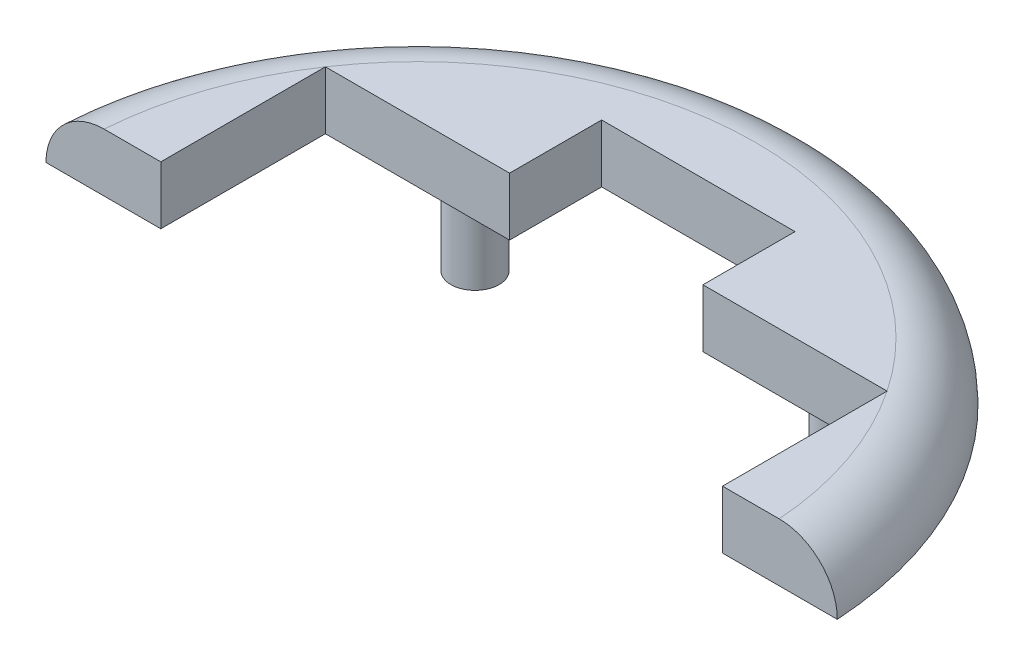
from build123d import *

# Parameters (mm, degrees)
BOSS_EXTRUDE1_DEPTH = 6
FILLET1_R           = 6
SKETCH2_R           = 2.5
SKETCH2_R_2         = 0.8
BOSS_EXTRUDE2_DEPTH = 10


with BuildPart() as part:
    # Sketch1 → Boss-Extrude1 (new body)
    with BuildSketch(Plane(origin=(0, 0, 0), x_dir=(1, 0, 0), z_dir=(0, 1, 0))):
        with BuildLine():
            Line((-40.923709509, 2.5), (-29.05, 2.5))
            Line((-29.05, 2.5), (-29.05, 19.525))
            Line((-29.05, 19.525), (-10, 19.525))
            Line((-10, 19.525), (-10, 29.05))
            Line((-10, 29.05), (10, 29.05))
            Line((10, 29.05), (10, 19.525))
            Line((10, 19.525), (29.05, 19.525))
            Line((29.05, 19.525), (29.05, 2.5))
            Line((29.05, 2.5), (40.923709509, 2.5))
            ThreePointArc((40.923709509, 2.5), (0, 41), (-40.923709509, 2.5))
        make_face()
    extrude(amount=BOSS_EXTRUDE1_DEPTH)

    # Fillet1
    fillet1_edges = [part.edges().sort_by_distance(p)[0] for p in [
        (0, 6, -41),
    ]]
    fillet(fillet1_edges, radius=FILLET1_R - 0.0001)  # a hair under: the kernel refuses the full size

    # Sketch2 → Boss-Extrude2 (add)
    # profile 1 of 2: a face of its own
    with BuildSketch(Plane.XZ):
        with Locations(Location((19.05, -25, 0), (0, 0, 270))):
            Circle(SKETCH2_R)
        with Locations(Location((19.05, -25, 0), (0, 0, 270))):
            Circle(SKETCH2_R_2, mode=Mode.SUBTRACT)
    # profile 2 of 2: a face of its own
    with BuildSketch(Plane.XZ):
        with Locations(Location((-19.05, -25, 0), (0, 0, 270))):
            Circle(SKETCH2_R)
        with Locations(Location((-19.05, -25, 0), (0, 0, 270))):
            Circle(SKETCH2_R_2, mode=Mode.SUBTRACT)
    extrude(amount=BOSS_EXTRUDE2_DEPTH)


solid = part.part
